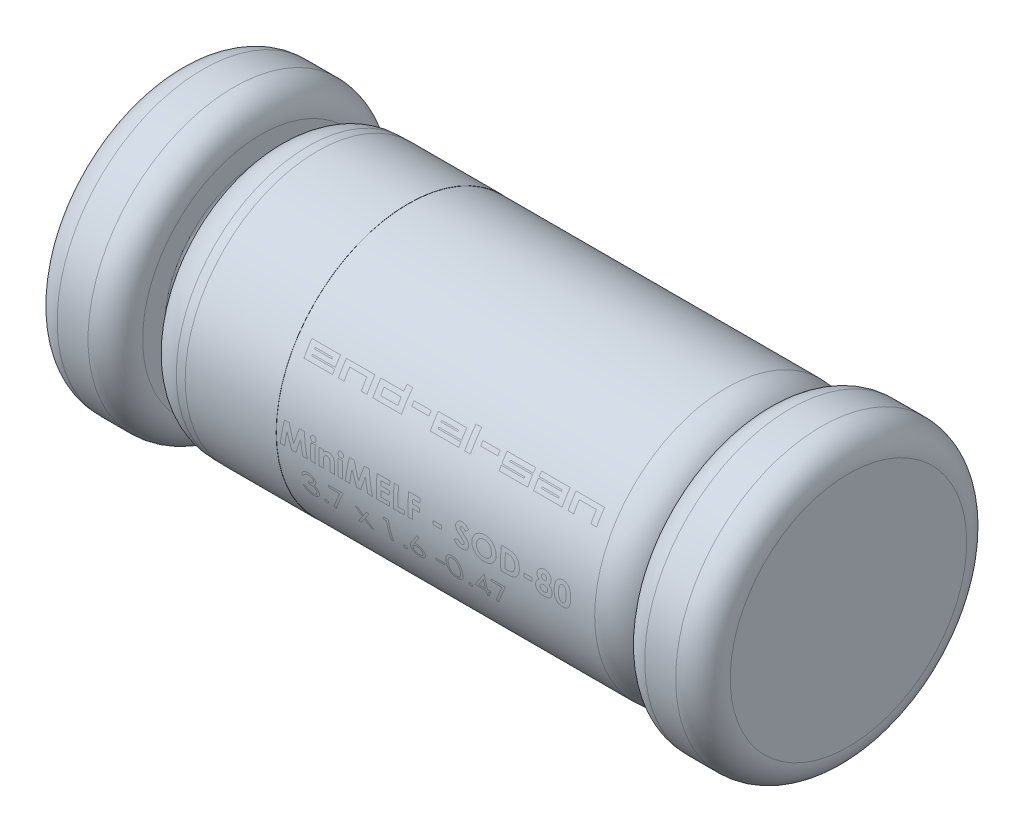
from build123d import *

# Parameters (mm, degrees)
IZIM2_R                     = 0.725
Y_KSEKLIK_EKSTR_ZYON3_DEPTH = 1.35
RADYUS1_R                   = 0.2
EKSTR_ZYON_NCE1_START       = -0.6
IZIM2_2_R                   = 0.726
IZIM2_2_R_2                 = 0.725
EKSTR_ZYON_NCE1_DEPTH       = 0.5
Y_KSEKLIK_EKSTR_ZYON6_START = 1.35
IZIM3_R                     = 0.5
Y_KSEKLIK_EKSTR_ZYON6_DEPTH = 0.06
Y_KSEKLIK_EKSTR_ZYON2_START = -1.41
IZIM1_R                     = 0.8
Y_KSEKLIK_EKSTR_ZYON2_DEPTH = 0.47
Y_KSEKLIK_EKSTR_ZYON7_START = 1.82
IZIM1_3_R                   = 0.8
Y_KSEKLIK_EKSTR_ZYON7_DEPTH = 0.47
RADYUS2_R                   = 0.15
RADYUS3_R                   = 0.03


with BuildPart() as part:
    # Çizim2 → Yükseklik-Ekstrüzyon3 (new, symmetric)
    with BuildSketch(Plane(origin=(0, 0, 0), x_dir=(0, 0, -1), z_dir=(1, 0, 0))):
        with Locations((-0.8, 0)):
            Circle(IZIM2_R)
    extrude(amount=Y_KSEKLIK_EKSTR_ZYON3_DEPTH, both=True)

    # Radyus1
    radyus1_edges = [part.edges().sort_by_distance(p)[0] for p in [
        (-1.35, 0, 1.525),
        (1.35, 0, 1.525),
    ]]
    fillet(radyus1_edges, radius=RADYUS1_R)

    # Çizim2<2> → Ekstrüzyon-İnce1 (add)
    with BuildSketch(Plane(origin=(0, 0, 0), x_dir=(0, 0, -1), z_dir=(1, 0, 0)).offset(EKSTR_ZYON_NCE1_START)):
        with Locations((-0.8, 0)):
            Circle(IZIM2_2_R)
        with Locations((-0.8, 0)):
            Circle(IZIM2_2_R_2, mode=Mode.SUBTRACT)
    extrude(amount=-EKSTR_ZYON_NCE1_DEPTH)

    # Çizim3 → Yükseklik-Ekstrüzyon6 (add)
    with BuildSketch(Plane.ZY.offset(Y_KSEKLIK_EKSTR_ZYON6_START)):
        with Locations((0.8, 0)):
            Circle(IZIM3_R)
    extrude(amount=Y_KSEKLIK_EKSTR_ZYON6_DEPTH)

    # Çizim1 → Yükseklik-Ekstrüzyon2 (add)
    with BuildSketch(Plane(origin=(0, 0, 0), x_dir=(0, 0, 1), z_dir=(1, 0, 0)).offset(Y_KSEKLIK_EKSTR_ZYON2_START)):
        with Locations((0.8, 0)):
            Circle(IZIM1_R)
    extrude(amount=-Y_KSEKLIK_EKSTR_ZYON2_DEPTH)

    # Çizim1<3> → Yükseklik-Ekstrüzyon7 (add)
    with BuildSketch(Plane(origin=(0, 0, 0), x_dir=(0, 0, 1), z_dir=(1, 0, 0)).offset(Y_KSEKLIK_EKSTR_ZYON7_START)):
        with Locations((0.8, 0)):
            Circle(IZIM1_3_R)
    extrude(amount=-Y_KSEKLIK_EKSTR_ZYON7_DEPTH)

    # Radyus2
    radyus2_edges = [part.edges().sort_by_distance(p)[0] for p in [
        (1.35, 0, 0),
        (1.82, 0, 0),
        (-1.41, 0, 0),
        (-1.88, 0, 0),
    ]]
    fillet(radyus2_edges, radius=RADYUS2_R)

    # Radyus3
    radyus3_edges = [part.edges().sort_by_distance(p)[0] for p in [
        (-1.41, 0, 0.3),
    ]]
    fillet(radyus3_edges, radius=RADYUS3_R)


solid = part.part
